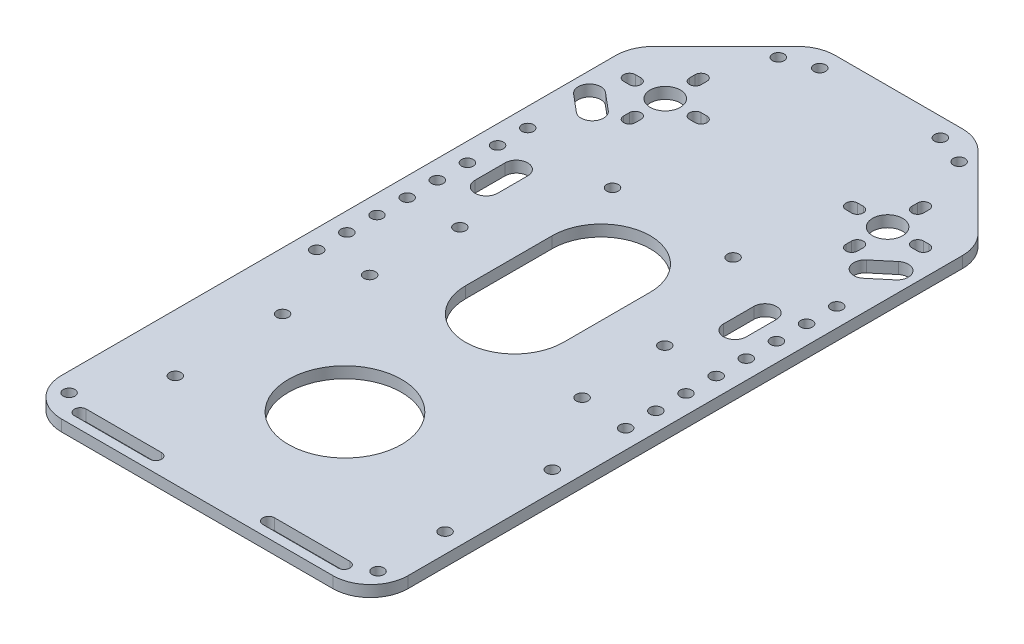
from build123d import *

# Parameters (mm, degrees)
SKETCH1_W           = 92
SKETCH1_H           = 186.23
SKETCH1_R           = 4
SKETCH1_R_2         = 1.55
SKETCH1_R_3         = 15
BOSS_EXTRUDE1_DEPTH = 3
CHAMFER1_SIZE       = 25
FILLET1_R           = 10


with BuildPart() as part:
    # Sketch1 → Boss-Extrude1 (new body)
    with BuildSketch(Plane(origin=(0, 0, 0), x_dir=(1, 0, 0), z_dir=(0, 1, 0))):
        with Locations((0, -60.615)):
            Rectangle(SKETCH1_W, SKETCH1_H)
        with Locations((29.5, 0)):
            Circle(SKETCH1_R, mode=Mode.SUBTRACT)
        with Locations((41, -25)):
            Circle(SKETCH1_R_2, mode=Mode.SUBTRACT)
        with Locations((-29.5, 0)):
            Circle(SKETCH1_R, mode=Mode.SUBTRACT)
        with Locations((16, 27.5)):
            Circle(SKETCH1_R_2, mode=Mode.SUBTRACT)
        with Locations((16, -27.5)):
            Circle(SKETCH1_R_2, mode=Mode.SUBTRACT)
        with Locations((-16, -27.5)):
            Circle(SKETCH1_R_2, mode=Mode.SUBTRACT)
        with Locations((-16, 27.5)):
            Circle(SKETCH1_R_2, mode=Mode.SUBTRACT)
        with Locations((-27.189233611, -56.821452148)):
            Circle(SKETCH1_R_2, mode=Mode.SUBTRACT)
        with Locations((-28.190778624, -79.7606043)):
            Circle(SKETCH1_R_2, mode=Mode.SUBTRACT)
        with Locations((28.190778624, -79.7606043)):
            Circle(SKETCH1_R_2, mode=Mode.SUBTRACT)
        with Locations((27.189233611, -56.821452148)):
            Circle(SKETCH1_R_2, mode=Mode.SUBTRACT)
        with Locations((40.79, -100.27)):
            Circle(SKETCH1_R_2, mode=Mode.SUBTRACT)
        with Locations((40.79, -128.73)):
            Circle(SKETCH1_R_2, mode=Mode.SUBTRACT)
        with Locations((-30.79, -128.73)):
            Circle(SKETCH1_R_2, mode=Mode.SUBTRACT)
        with Locations((-30.79, -100.27)):
            Circle(SKETCH1_R_2, mode=Mode.SUBTRACT)
        with Locations((41, -33)):
            Circle(SKETCH1_R_2, mode=Mode.SUBTRACT)
        with Locations((41, -41)):
            Circle(SKETCH1_R_2, mode=Mode.SUBTRACT)
        with Locations((41, -49)):
            Circle(SKETCH1_R_2, mode=Mode.SUBTRACT)
        with Locations((41, -57)):
            Circle(SKETCH1_R_2, mode=Mode.SUBTRACT)
        with Locations((41, -65)):
            Circle(SKETCH1_R_2, mode=Mode.SUBTRACT)
        with Locations((41, -73)):
            Circle(SKETCH1_R_2, mode=Mode.SUBTRACT)
        with Locations((41, -81)):
            Circle(SKETCH1_R_2, mode=Mode.SUBTRACT)
        with Locations((-41, -81)):
            Circle(SKETCH1_R_2, mode=Mode.SUBTRACT)
        with Locations((-41, -73)):
            Circle(SKETCH1_R_2, mode=Mode.SUBTRACT)
        with Locations((-41, -65)):
            Circle(SKETCH1_R_2, mode=Mode.SUBTRACT)
        with Locations((-41, -57)):
            Circle(SKETCH1_R_2, mode=Mode.SUBTRACT)
        with Locations((-41, -49)):
            Circle(SKETCH1_R_2, mode=Mode.SUBTRACT)
        with Locations((-41, -41)):
            Circle(SKETCH1_R_2, mode=Mode.SUBTRACT)
        with Locations((-41, -33)):
            Circle(SKETCH1_R_2, mode=Mode.SUBTRACT)
        with Locations((-41, -25)):
            Circle(SKETCH1_R_2, mode=Mode.SUBTRACT)
        with Locations((24, 24.5)):
            Circle(SKETCH1_R_2, mode=Mode.SUBTRACT)
        with Locations((-24, 24.5)):
            Circle(SKETCH1_R_2, mode=Mode.SUBTRACT)
        with Locations((41, -146.73)):
            Circle(SKETCH1_R_2, mode=Mode.SUBTRACT)
        with Locations((-41, -146.73)):
            Circle(SKETCH1_R_2, mode=Mode.SUBTRACT)
        with Locations((0, -114.5)):
            Circle(SKETCH1_R_3, mode=Mode.SUBTRACT)
        with BuildLine():
            Line((37.5, 1.55), (39, 1.55))
            ThreePointArc((39, 1.55), (40.55, 0), (39, -1.55))
            Line((39, -1.55), (37.5, -1.55))
            ThreePointArc((37.5, -1.55), (35.95, 0), (37.5, 1.55))
        make_face(mode=Mode.SUBTRACT)
        with BuildLine():
            Line((31.05, -8), (31.05, -9.5))
            ThreePointArc((31.05, -9.5), (29.5, -11.05), (27.95, -9.5))
            Line((27.95, -9.5), (27.95, -8))
            ThreePointArc((27.95, -8), (29.5, -6.45), (31.05, -8))
        make_face(mode=Mode.SUBTRACT)
        with BuildLine():
            Line((21.5, -1.55), (20, -1.55))
            ThreePointArc((20, -1.55), (18.45, 0), (20, 1.55))
            Line((20, 1.55), (21.5, 1.55))
            ThreePointArc((21.5, 1.55), (23.05, 0), (21.5, -1.55))
        make_face(mode=Mode.SUBTRACT)
        with BuildLine():
            Line((27.95, 8), (27.95, 9.5))
            ThreePointArc((27.95, 9.5), (29.5, 11.05), (31.05, 9.5))
            Line((31.05, 9.5), (31.05, 8))
            ThreePointArc((31.05, 8), (29.5, 6.45), (27.95, 8))
        make_face(mode=Mode.SUBTRACT)
        with BuildLine():
            Line((-27.95, 8), (-27.95, 9.5))
            ThreePointArc((-27.95, 9.5), (-29.5, 11.05), (-31.05, 9.5))
            Line((-31.05, 9.5), (-31.05, 8))
            ThreePointArc((-31.05, 8), (-29.5, 6.45), (-27.95, 8))
        make_face(mode=Mode.SUBTRACT)
        with BuildLine():
            Line((-21.5, -1.55), (-20, -1.55))
            ThreePointArc((-20, -1.55), (-18.45, 0), (-20, 1.55))
            Line((-20, 1.55), (-21.5, 1.55))
            ThreePointArc((-21.5, 1.55), (-23.05, 0), (-21.5, -1.55))
        make_face(mode=Mode.SUBTRACT)
        with BuildLine():
            Line((-31.05, -8), (-31.05, -9.5))
            ThreePointArc((-31.05, -9.5), (-29.5, -11.05), (-27.95, -9.5))
            Line((-27.95, -9.5), (-27.95, -8))
            ThreePointArc((-27.95, -8), (-29.5, -6.45), (-31.05, -8))
        make_face(mode=Mode.SUBTRACT)
        with BuildLine():
            Line((-37.5, 1.55), (-39, 1.55))
            ThreePointArc((-39, 1.55), (-40.55, 0), (-39, -1.55))
            Line((-39, -1.55), (-37.5, -1.55))
            ThreePointArc((-37.5, -1.55), (-35.95, 0), (-37.5, 1.55))
        make_face(mode=Mode.SUBTRACT)
        with BuildLine():
            Line((13, -46.5), (13, -69.5))
            ThreePointArc((13, -69.5), (0, -82.5), (-13, -69.5))
            Line((-13, -69.5), (-13, -46.5))
            ThreePointArc((-13, -46.5), (0, -33.5), (13, -46.5))
        make_face(mode=Mode.SUBTRACT)
        with BuildLine():
            Line((42.725522694, -11.094392704), (38.129256035, -14.951118362))
            ThreePointArc((38.129256035, -14.951118362), (33.902759877, -14.581347862), (34.272530377, -10.354851703))
            Line((34.272530377, -10.354851703), (38.868797036, -6.498126045))
            ThreePointArc((38.868797036, -6.498126045), (43.095293194, -6.867896546), (42.725522694, -11.094392704))
        make_face(mode=Mode.SUBTRACT)
        with BuildLine():
            Line((-42.725522694, -11.094392704), (-38.129256035, -14.951118362))
            ThreePointArc((-38.129256035, -14.951118362), (-33.902759877, -14.581347862), (-34.272530377, -10.354851703))
            Line((-34.272530377, -10.354851703), (-38.868797036, -6.498126045))
            ThreePointArc((-38.868797036, -6.498126045), (-43.095293194, -6.867896546), (-42.725522694, -11.094392704))
        make_face(mode=Mode.SUBTRACT)
        with BuildLine():
            Line((36, -36), (36, -44))
            ThreePointArc((36, -44), (33, -47), (30, -44))
            Line((30, -44), (30, -36))
            ThreePointArc((30, -36), (33, -33), (36, -36))
        make_face(mode=Mode.SUBTRACT)
        with BuildLine():
            Line((-36, -36), (-36, -44))
            ThreePointArc((-36, -44), (-33, -47), (-30, -44))
            Line((-30, -44), (-30, -36))
            ThreePointArc((-30, -36), (-33, -33), (-36, -36))
        make_face(mode=Mode.SUBTRACT)
        with BuildLine():
            Line((15, -148.18), (35, -148.18))
            ThreePointArc((35, -148.18), (36.55, -149.73), (35, -151.28))
            Line((35, -151.28), (15, -151.28))
            ThreePointArc((15, -151.28), (13.45, -149.73), (15, -148.18))
        make_face(mode=Mode.SUBTRACT)
        with BuildLine():
            Line((-15, -148.18), (-35, -148.18))
            ThreePointArc((-35, -148.18), (-36.55, -149.73), (-35, -151.28))
            Line((-35, -151.28), (-15, -151.28))
            ThreePointArc((-15, -151.28), (-13.45, -149.73), (-15, -148.18))
        make_face(mode=Mode.SUBTRACT)
    extrude(amount=BOSS_EXTRUDE1_DEPTH)

    # Chamfer1
    chamfer1_edges = [part.edges().sort_by_distance(p)[0] for p in [
        (46, 1.5, -32.5),
        (-46, 1.5, -32.5),
    ]]
    chamfer(chamfer1_edges, length=CHAMFER1_SIZE)

    # Fillet1
    fillet1_edges = [part.edges().sort_by_distance(p)[0] for p in [
        (-46, 1.5, 153.73),
        (46, 1.5, 153.73),
        (46, 1.5, -7.5),
        (21, 1.5, -32.5),
        (-46, 1.5, -7.5),
        (-21, 1.5, -32.5),
    ]]
    fillet(fillet1_edges, radius=FILLET1_R)


solid = part.part
